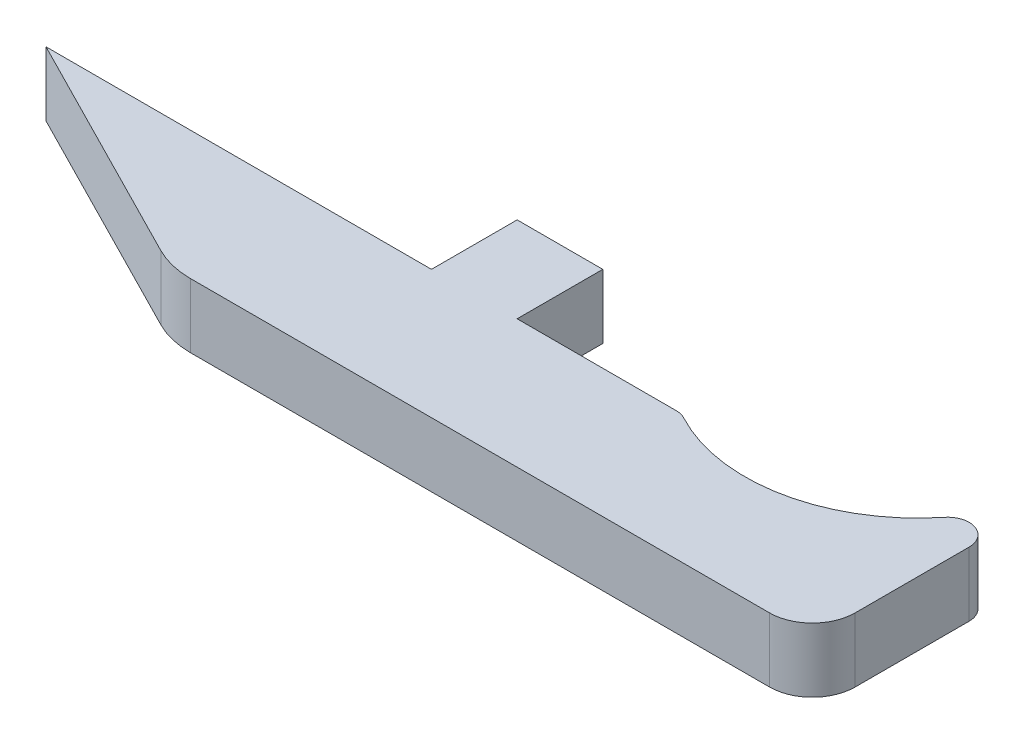
from build123d import *

# Parameters (mm, degrees)
BOSS_EXTRUDE1_DEPTH = 4.7625
FILLET1_R           = 1.5875
FILLET2_R           = 6.35
FILLET3_R           = 3.175
SKETCH6_W           = 6.35
SKETCH6_H           = 4.7625
BOSS_EXTRUDE2_DEPTH = 6.35


with BuildPart() as part:
    # Sketch1 → Boss-Extrude1 (new body)
    with BuildSketch(Plane(origin=(0, 0, 0), x_dir=(1, 0, 0), z_dir=(0, 1, 0))):
        with BuildLine():
            ThreePointArc((71.8566, 1.079931584), (65.45758311, -10.020201845), (52.645098926, -10.045268416))
            Line((52.645098926, -10.045268416), (5.5225, -10.045268416))
            Line((5.5225, -10.045268416), (24.2316, -19.570268416))
            Line((24.2316, -19.570268416), (71.8566, -19.570268416))
            Line((71.8566, -19.570268416), (71.8566, 1.079931584))
        make_face()
    extrude(amount=BOSS_EXTRUDE1_DEPTH)

    # Fillet1
    fillet1_edges = [part.edges().sort_by_distance(p)[0] for p in [
        (52.645098926, 2.38125, 10.045268416),
        (71.8566, 2.38125, -1.079931584),
    ]]
    fillet(fillet1_edges, radius=FILLET1_R)

    # Fillet2
    fillet2_edges = [part.edges().sort_by_distance(p)[0] for p in [
        (24.2316, 2.38125, 19.570268416),
    ]]
    fillet(fillet2_edges, radius=FILLET2_R)

    # Fillet3
    fillet3_edges = [part.edges().sort_by_distance(p)[0] for p in [
        (71.8566, 2.38125, 19.570268416),
    ]]
    fillet(fillet3_edges, radius=FILLET3_R)

    # Sketch6 → Boss-Extrude2 (add)
    with BuildSketch(Plane(origin=(0, 0, 10.045268416), x_dir=(-1, 0, 0), z_dir=(0, 0, -1))):
        with Locations((-37.2725, 2.38125)):
            Rectangle(SKETCH6_W, SKETCH6_H)
    extrude(amount=BOSS_EXTRUDE2_DEPTH)


solid = part.part
